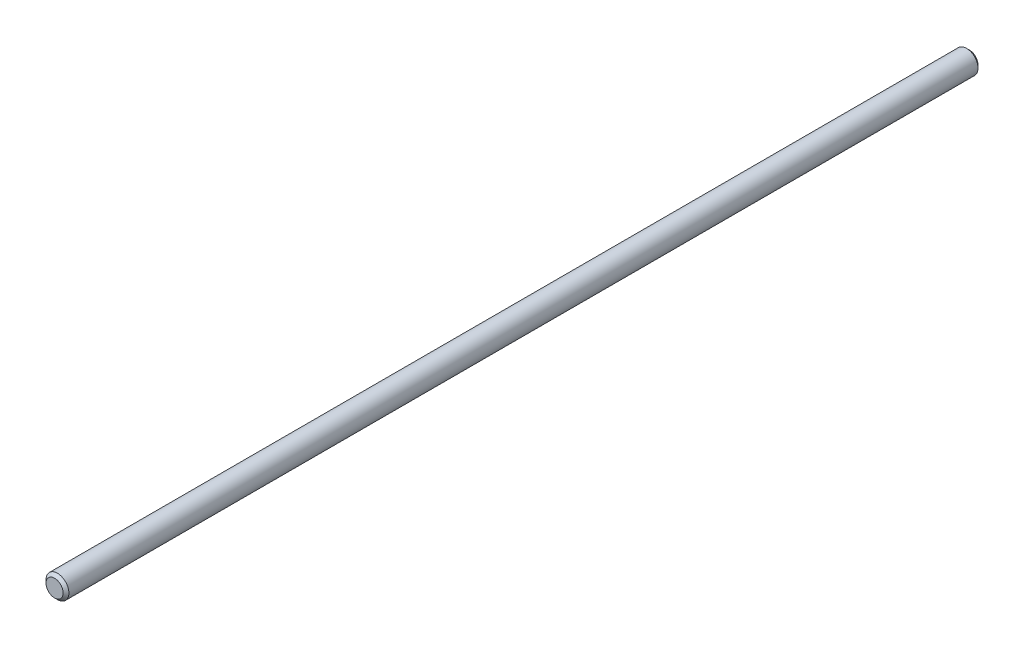
from build123d import *

# Parameters (mm, degrees)
SCHIZZO1_R                   = 4
ESTRUSIONE_ESTRUSIONE1_DEPTH = 320
SMUSSO1_SIZE                 = 1


with BuildPart() as part:
    # Schizzo1 → Estrusione-Estrusione1 (new body)
    with BuildSketch(Plane.XY):
        Circle(SCHIZZO1_R)
    extrude(amount=ESTRUSIONE_ESTRUSIONE1_DEPTH)

    # Smusso1
    smusso1_edges = [part.edges().sort_by_distance(p)[0] for p in [
        (-4, 0, 320),
        (-4, 0, 0),
    ]]
    chamfer(smusso1_edges, length=SMUSSO1_SIZE)


solid = part.part
